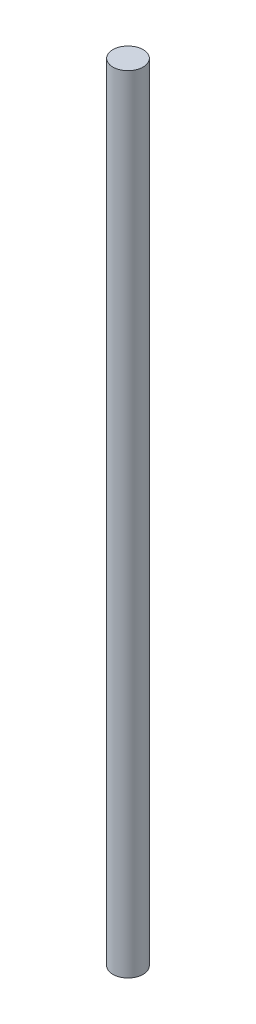
from build123d import *

# Parameters (mm, degrees)
SKETCH1_R           = 4.7625
BOSS_EXTRUDE1_DEPTH = 247.65


with BuildPart() as part:
    # Sketch1 → Boss-Extrude1 (new body)
    with BuildSketch(Plane(origin=(0, 0, 0), x_dir=(1, 0, 0), z_dir=(0, 1, 0))):
        Circle(SKETCH1_R)
    extrude(amount=BOSS_EXTRUDE1_DEPTH)


solid = part.part
